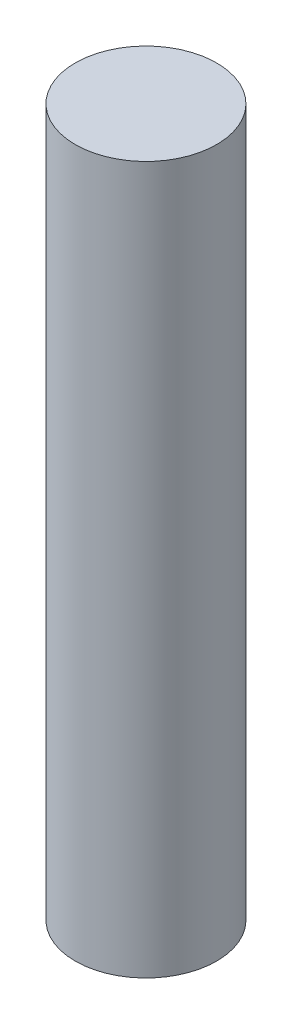
from build123d import *

# Parameters (mm, degrees)
SKETCH1_R           = 6
BOSS_EXTRUDE1_DEPTH = 60


with BuildPart() as part:
    # Sketch1 → Boss-Extrude1 (new body)
    with BuildSketch(Plane(origin=(0, 0, 0), x_dir=(1, 0, 0), z_dir=(0, 1, 0))):
        Circle(SKETCH1_R)
    extrude(amount=BOSS_EXTRUDE1_DEPTH)


solid = part.part
